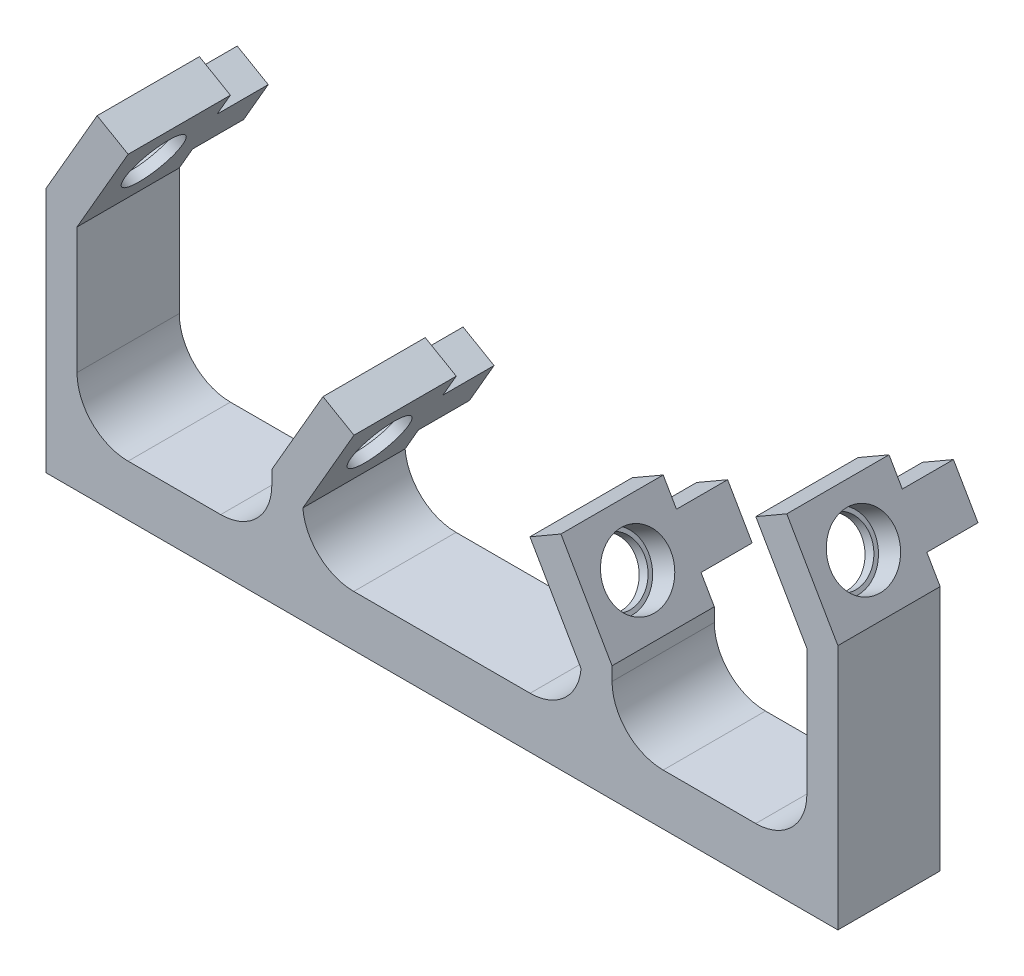
from build123d import *

# Parameters (mm, degrees)
BOSS_EXTRU_1_DEPTH      = 10
ESQUISSE2_R             = 6.5
ENL_V_MAT_EXTRU_1_DEPTH = 63
ESQUISSE3_R             = 6.5
ENL_V_MAT_EXTRU_2_DEPTH = 63
CONG_1_R                = 10
CONG_2_R                = 10
BOSS_EXTRU_2_START      = -2
ESQUISSE4_R             = 6.5
ESQUISSE4_R_2           = 5.7
BOSS_EXTRU_2_DEPTH      = 2
BOSS_EXTRU_3_START      = -2
ESQUISSE5_R             = 6.5
ESQUISSE5_R_2           = 5.7
BOSS_EXTRU_3_DEPTH      = 2
BOSS_EXTRU_4_START      = -2
ESQUISSE6_R             = 6.5
ESQUISSE6_R_2           = 5.7
BOSS_EXTRU_4_DEPTH      = 2
BOSS_EXTRU_5_START      = -2
ESQUISSE7_R             = 6.5
ESQUISSE7_R_2           = 5.7
BOSS_EXTRU_5_DEPTH      = 2
BOSS_EXTRU_6_DEPTH      = 10


with BuildPart() as part:
    # Esquisse1 → Boss.-Extru.1 (new, symmetric)
    with BuildSketch(Plane.XY):
        Polygon((23.267949192, 24.980762114), (33.267949192, 7.660254038), (33.267949192, -5), (71.373066959, -5), (71.373066959, 29.660254038), (61.373066959, 46.980762114), (67.435244785, 50.480762114), (77.435244785, 33.160254038), (77.435244785, -15), (71.373066959, -15), (-71.373066959, -15), (-77.435244785, -15), (-77.435244785, 33.160254038), (-67.435244785, 50.480762114), (-61.373066959, 46.980762114), (-71.373066959, 29.660254038), (-71.373066959, -5), (-33.267949192, -5), (-33.267949192, 7.660254038), (-23.267949192, 24.980762114), (-17.205771366, 21.480762114), (-27.205771366, 4.160254038), (-27.205771366, -5), (27.205771366, -5), (27.205771366, 4.160254038), (17.205771366, 21.480762114), align=None)
    extrude(amount=BOSS_EXTRU_1_DEPTH, both=True)

    # Esquisse2 → Enlèv. mat.-Extru.1 (cut)
    with BuildSketch(Plane(origin=(-72.435244785, 41.820508076, 0), x_dir=(0, 0, 1), z_dir=(-0.8660254037844399, 0.4999999999999977, 0))):
        with Locations(Location((0, 0, 0), (0, 0, 270))):
            Circle(ESQUISSE2_R)
    extrude(amount=-ENL_V_MAT_EXTRU_1_DEPTH, mode=Mode.SUBTRACT)

    # Esquisse3 → Enlèv. mat.-Extru.2 (cut)
    with BuildSketch(Plane(origin=(72.435244785, 41.820508076, 0), x_dir=(0, 0, -1), z_dir=(0.86602540378444, 0.4999999999999975, 0))):
        with Locations(Location((0, 0, 0), (0, 0, 90))):
            Circle(ESQUISSE3_R)
    extrude(amount=-ENL_V_MAT_EXTRU_2_DEPTH, mode=Mode.SUBTRACT)

    # Congé1
    cong_1_edges = [part.edges().sort_by_distance(p)[0] for p in [
        (33.267949192, -5, 0),
        (71.373066959, -5, 0),
        (-71.373066959, -5, 0),
        (-33.267949192, -5, 0),
    ]]
    fillet(cong_1_edges, radius=CONG_1_R)

    # Congé2
    # the kernel refuses this fillet: 10 mm, written as the material it adds along each edge
    with BuildSketch(Plane(origin=(-27.205771366, -5, 10), x_dir=(1, 0, 0), z_dir=(0, 0, -1))) as cong_2_piece_1:
        with BuildLine():
            CenterArc((9.964678957, -10), CONG_2_R, 90, 85.182937258)
            Line((0, -9.160254038), (-0.199293579, -9.143459119))
            ThreePointArc((-0.199293579, -9.143459119), (-0.2, -4.580127019), (-0.2, 0))
            Line((-0.2, 0), (0, 0.2))
            Line((0, 0.2), (9.964678957, 0.2))
            Line((9.964678957, 0.2), (9.964678957, 0))
        make_face()
    extrude(amount=20)
    with BuildSketch(Plane(origin=(27.205771366, -5, 10), x_dir=(0, 1, 0), z_dir=(0, 0, -1))) as cong_2_piece_2:
        with BuildLine():
            CenterArc((10, -9.964678957), CONG_2_R, 94.817062742, 85.182937258)
            Line((0, -9.964678957), (-0.2, -9.964678957))
            Line((-0.2, -9.964678957), (-0.2, 0))
            Line((-0.2, 0), (0, 0.2))
            ThreePointArc((0, 0.2), (4.580127019, 0.2), (9.143459119, 0.199293579))
            Line((9.143459119, 0.199293579), (9.160254038, 0))
        make_face()
    extrude(amount=20)

    # Esquisse4 → Boss.-Extru.2 (add)
    with BuildSketch(Plane(origin=(-22.205771366, 12.820508076, 0), x_dir=(0, 0, -1), z_dir=(0.8660254037844398, -0.49999999999999817, 0)).offset(BOSS_EXTRU_2_START)):
        with Locations(Location((0, 0, 0), (0, 0, 90))):
            Circle(ESQUISSE4_R)
        with Locations(Location((0, 0, 0), (0, 0, 90))):
            Circle(ESQUISSE4_R_2, mode=Mode.SUBTRACT)
    extrude(amount=BOSS_EXTRU_2_DEPTH)

    # Esquisse5 → Boss.-Extru.3 (add)
    with BuildSketch(Plane(origin=(-66.373066959, 38.320508076, 0), x_dir=(0, 0, -1), z_dir=(0.8660254037844398, -0.49999999999999817, 0)).offset(BOSS_EXTRU_3_START)):
        with Locations(Location((0, 0, 0), (0, 0, 270))):
            Circle(ESQUISSE5_R)
        with Locations(Location((0, 0, 0), (0, 0, 90))):
            Circle(ESQUISSE5_R_2, mode=Mode.SUBTRACT)
    extrude(amount=BOSS_EXTRU_3_DEPTH)

    # Esquisse6 → Boss.-Extru.4 (add)
    with BuildSketch(Plane(origin=(22.205771366, 12.820508076, 0), x_dir=(0, 0, 1), z_dir=(-0.8660254037844398, -0.49999999999999817, 0)).offset(BOSS_EXTRU_4_START)):
        with Locations(Location((0, 0, 0), (0, 0, 270))):
            Circle(ESQUISSE6_R)
        with Locations(Location((0, 0, 0), (0, 0, 270))):
            Circle(ESQUISSE6_R_2, mode=Mode.SUBTRACT)
    extrude(amount=BOSS_EXTRU_4_DEPTH)

    # Esquisse7 → Boss.-Extru.5 (add)
    with BuildSketch(Plane(origin=(66.373066959, 38.320508076, 0), x_dir=(0, 0, 1), z_dir=(-0.8660254037844398, -0.49999999999999817, 0)).offset(BOSS_EXTRU_5_START)):
        with Locations(Location((0, 0, 0), (0, 0, 90))):
            Circle(ESQUISSE7_R)
        with Locations(Location((0, 0, 0), (0, 0, 270))):
            Circle(ESQUISSE7_R_2, mode=Mode.SUBTRACT)
    extrude(amount=BOSS_EXTRU_5_DEPTH)

    # Esquisse8 → Boss.-Extru.6 (add)
    with BuildSketch(Plane(origin=(0, 0, -10), x_dir=(-1, 0, 0), z_dir=(0, 0, -1))):
        Polygon((63.973066959, 42.477430014), (70.035244785, 45.977430014), (74.835244785, 37.663586138), (68.773066959, 34.163586138), align=None)
        Polygon((19.805771366, 16.977430014), (25.867949192, 20.477430014), (30.667949192, 12.163586138), (24.605771366, 8.663586138), align=None)
        Polygon((-25.867949192, 20.477430014), (-19.805771366, 16.977430014), (-24.605771366, 8.663586138), (-30.667949192, 12.163586138), align=None)
        Polygon((-70.035244785, 45.977430014), (-63.973066959, 42.477430014), (-68.773066959, 34.163586138), (-74.835244785, 37.663586138), align=None)
    extrude(amount=BOSS_EXTRU_6_DEPTH)


solid = part.part
